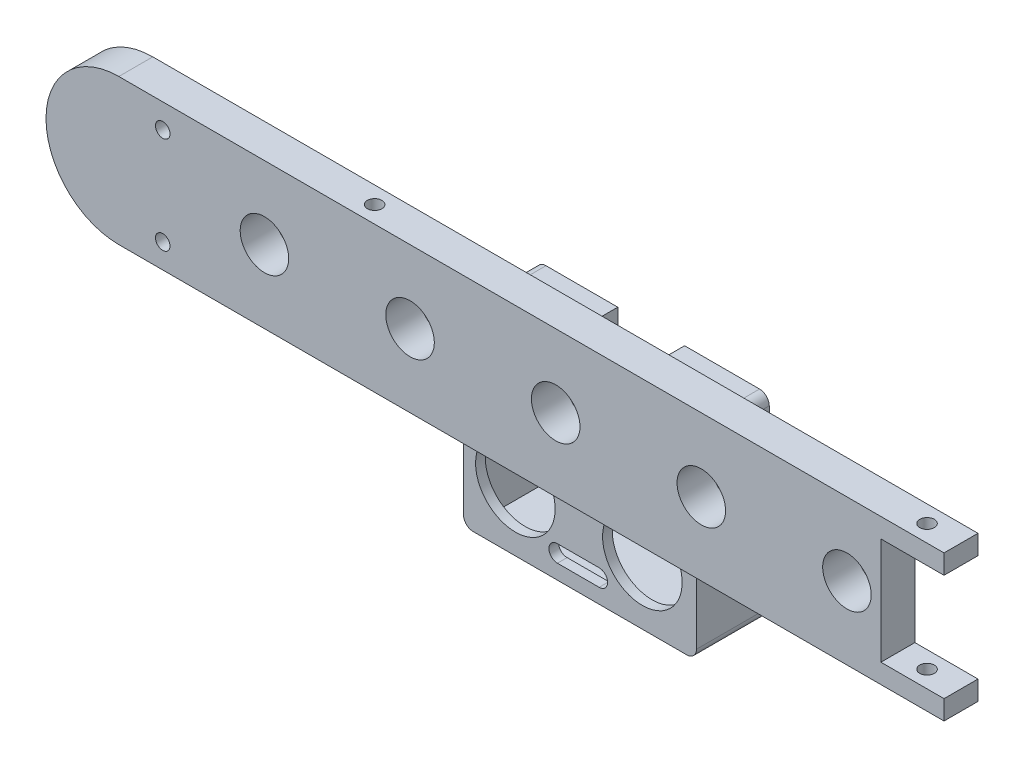
from build123d import *

# Parameters (mm, degrees)
BOSS_EXTRUDE1_DEPTH      = 7
SKETCH2_R                = 5
CUT_EXTRUDE1_DEPTH       = 7
LPATTERN1_COUNT          = 7
LPATTERN1_PITCH          = 30
SKETCH6_R                = 5
CUT_EXTRUDE2_DEPTH       = 10
CUT_EXTRUDE4_REACH       = 219.196
SKETCH9_R                = 1.5
CUT_EXTRUDE9_REACH       = 219.196
SKETCH15_R               = 1.5
SKETCH15_R_2             = 2.5
SKETCH16_W               = 48
SKETCH16_H               = 39.930416712
SKETCH16_R               = 8.2
BOSS_EXTRUDE2_DEPTH      = 15
SKETCH17_W               = 45.833760325
SKETCH17_H               = 30.12512517
SKETCH17_W_2             = 13.763297708
SKETCH17_H_2             = 9.222578979
CUT_EXTRUDE15_DEPTH      = 13
CUT_EXTRUDE16_REACH      = 224.218
SKETCH18_W               = 140
SKETCH18_H               = 115.832892108
FILLET1_R                = 2
BOSS_EXTRUDE4_DEPTH      = 7
CUT_EXTRUDE17_DEPTH      = 10
SKETCH27_W               = 7
SKETCH27_H               = 22
CUT_EXTRUDE18_DEPTH      = 13
CUT_EXTRUDE19_DEPTH      = 266.512692236
CUT_EXTRUDE19_DEPTH_BACK = 266.512692236
SKETCH28_R               = 1.5
CUT_EXTRUDE20_DEPTH      = 266.512692236
CUT_EXTRUDE20_DEPTH_BACK = 266.512692236
SKETCH29_R               = 5


with BuildPart() as part:
    # Sketch1 → Boss-Extrude1 (new body)
    with BuildSketch(Plane.XY):
        with BuildLine():
            Line((-200, 0), (50, 0))
            ThreePointArc((50, 0), (65, -15), (50, -30))
            Line((50, -30), (-200, -30))
            ThreePointArc((-200, -30), (-215, -15), (-200, 0))
        make_face()
    extrude(amount=BOSS_EXTRUDE1_DEPTH)

    # Sketch2 → Cut-Extrude1 (cut)
    with BuildSketch(Plane.XY.offset(7)):
        with Locations((-185, -15)):
            Circle(SKETCH2_R)
    cut_extrude1 = extrude(amount=-CUT_EXTRUDE1_DEPTH, mode=Mode.SUBTRACT)

    # LPattern1: Cut-Extrude1 ×7
    with Locations(*[(i * LPATTERN1_PITCH, 0, 0) for i in range(1, LPATTERN1_COUNT)]):
        add(cut_extrude1, mode=Mode.SUBTRACT)

    # Sketch6 → Cut-Extrude2 (cut)
    with BuildSketch(Plane(origin=(0, 0, 0), x_dir=(-1, 0, 0), z_dir=(0, 0, -1))):
        with Locations((-50, -15)):
            Circle(SKETCH6_R)
    extrude(amount=-CUT_EXTRUDE2_DEPTH, mode=Mode.SUBTRACT)

    # Sketch9 → Cut-Extrude4 (cut, up to next)
    with BuildSketch(Plane(origin=(0, 0, 0), x_dir=(-1, 0, 0), z_dir=(0, 0, -1)), mode=Mode.PRIVATE) as cut_extrude4_sk1:
        with Locations((-29.5, -6.25)):
            Circle(SKETCH9_R)
    cut_extrude4_tool1 = extrude(cut_extrude4_sk1.sketch, amount=-CUT_EXTRUDE4_REACH, mode=Mode.PRIVATE) & part.part
    # Sketch9 → Cut-Extrude4 (cut, up to next)
    with BuildSketch(Plane(origin=(0, 0, 0), x_dir=(-1, 0, 0), z_dir=(0, 0, -1)), mode=Mode.PRIVATE) as cut_extrude4_sk2:
        with Locations((-29.5, -23.75)):
            Circle(SKETCH9_R)
    cut_extrude4_tool2 = extrude(cut_extrude4_sk2.sketch, amount=-CUT_EXTRUDE4_REACH, mode=Mode.PRIVATE) & part.part
    add(cut_extrude4_tool1.solids().sort_by_distance((29.5, -6.25, 0))[0], mode=Mode.SUBTRACT)
    add(cut_extrude4_tool2.solids().sort_by_distance((29.5, -23.75, 0))[0], mode=Mode.SUBTRACT)

    # Sketch15 → Cut-Extrude9 (cut, up to next)
    with BuildSketch(Plane(origin=(0, 0, 0), x_dir=(1, 0, 0), z_dir=(0, 1, 0)), mode=Mode.PRIVATE) as cut_extrude9_sk1:
        with Locations(Location((-195.8, -3.5, 0), (0, 0, 180))):
            Circle(SKETCH15_R)
    cut_extrude9_tool1 = extrude(cut_extrude9_sk1.sketch, amount=-CUT_EXTRUDE9_REACH, mode=Mode.PRIVATE) & part.part
    # Sketch15 → Cut-Extrude9 (cut, up to next)
    with BuildSketch(Plane(origin=(0, 0, 0), x_dir=(1, 0, 0), z_dir=(0, 1, 0)), mode=Mode.PRIVATE) as cut_extrude9_sk2:
        with Locations(Location((45.8, -3.5, 0), (0, 0, 180))):
            Circle(SKETCH15_R_2)
    cut_extrude9_tool2 = extrude(cut_extrude9_sk2.sketch, amount=-CUT_EXTRUDE9_REACH, mode=Mode.PRIVATE) & part.part
    add(cut_extrude9_tool1.solids().sort_by_distance((-195.8, 0, 3.5))[0], mode=Mode.SUBTRACT)
    add(cut_extrude9_tool2.solids().sort_by_distance((45.8, 0, 3.5))[0], mode=Mode.SUBTRACT)

    # Sketch16 → Boss-Extrude2 (add)
    with BuildSketch(Plane(origin=(0, 0, 0), x_dir=(-1, 0, 0), z_dir=(0, 0, -1))):
        with Locations((157, -31.726084321)):
            Rectangle(SKETCH16_W, SKETCH16_H)
        with Locations((144.145834, -39.243444981)):
            Circle(SKETCH16_R, mode=Mode.SUBTRACT)
        with Locations((170.306394211, -39.243444981)):
            Circle(SKETCH16_R, mode=Mode.SUBTRACT)
        with BuildLine():
            Line((153.043612384, -45.175236858), (161.648055614, -45.175236858))
            ThreePointArc((161.648055614, -45.175236858), (163.390378659, -46.917559902), (161.648055614, -48.659882947))
            Line((161.648055614, -48.659882947), (153.043612384, -48.659882947))
            ThreePointArc((153.043612384, -48.659882947), (151.301289339, -46.917559902), (153.043612384, -45.175236858))
        make_face(mode=Mode.SUBTRACT)
    extrude(amount=BOSS_EXTRUDE2_DEPTH)

    # Sketch17 → Cut-Extrude15 (cut)
    with BuildSketch(Plane(origin=(0, 0, -15), x_dir=(-1, 0, 0), z_dir=(0, 0, -1))):
        with Locations((156.666880163, -35.963336462)):
            Rectangle(SKETCH17_W, SKETCH17_H)
        with Locations((157.326506844, -16.372165454)):
            Rectangle(SKETCH17_W_2, SKETCH17_H_2)
    extrude(amount=-CUT_EXTRUDE15_DEPTH, mode=Mode.SUBTRACT)

    # Sketch18 → Cut-Extrude16 (cut, up to next)
    with BuildSketch(Plane.XY.offset(7), mode=Mode.PRIVATE) as cut_extrude16_sk1:
        with Locations((-5, -15.036727437)):
            Rectangle(SKETCH18_W, SKETCH18_H)
    cut_extrude16_tool1 = extrude(cut_extrude16_sk1.sketch, amount=-CUT_EXTRUDE16_REACH, mode=Mode.PRIVATE) & part.part
    add(cut_extrude16_tool1.solids().sort_by_distance((-5, -15.036727, 7))[0], mode=Mode.SUBTRACT)

    # Fillet1
    # the kernel refuses this fillet: 2 mm, written as the material it takes off along each edge
    with BuildSketch(Plane(origin=(-133, -51.691292677, 5), x_dir=(0, 1, 0), z_dir=(0, 0, -1))) as fillet1_piece_1:
        with BuildLine():
            CenterArc((FILLET1_R, -FILLET1_R), FILLET1_R, 90, 90)
            Line((0, -FILLET1_R), (0, 0))
            Line((0, 0), (FILLET1_R, 0))
        make_face()
    extrude(amount=25, mode=Mode.SUBTRACT)
    with BuildSketch(Plane(origin=(-181, -51.691292677, 5), x_dir=(0, 1, 0), z_dir=(0, 0, -1))) as fillet1_piece_2:
        with BuildLine():
            CenterArc((FILLET1_R, FILLET1_R), FILLET1_R, 180, 90)
            Line((0, FILLET1_R), (0, 0))
            Line((0, 0), (FILLET1_R, 0))
        make_face()
    extrude(amount=25, mode=Mode.SUBTRACT)
    with BuildSketch(Plane(origin=(-181, -11.760875965, 0), x_dir=(0, -1, 0), z_dir=(0, 0, -1)), Plane(origin=(-133, -11.760875965, 0), x_dir=(-1, 0, 0), z_dir=(0, 0, -1))) as fillet1_piece_3:
        with BuildLine():
            CenterArc((FILLET1_R, -FILLET1_R), FILLET1_R, 90, 90)
            Line((0, -FILLET1_R), (0, 0))
            Line((0, 0), (FILLET1_R, 0))
        make_face()
    extrude(amount=20, mode=Mode.SUBTRACT)

    # Sketch24 → Boss-Extrude4 (add)
    with BuildSketch(Plane(origin=(0, 0, 0), x_dir=(-1, 0, 0), z_dir=(0, 0, -1))):
        with BuildLine():
            ThreePointArc((245, 0), (260, -15), (245, -30))
            Line((245, -30), (245, 0))
        make_face()
        with BuildLine():
            Line((245, 0), (245, -30))
            Line((245, -30), (200, -30))
            ThreePointArc((200, -30), (215, -15), (200, 0))
            Line((200, 0), (245, 0))
        make_face()
    extrude(amount=-BOSS_EXTRUDE4_DEPTH)

    # Sketch25 → Cut-Extrude17 (cut)
    with BuildSketch(Plane(origin=(0, 0, 0), x_dir=(-1, 0, 0), z_dir=(0, 0, -1))):
        with BuildLine():
            ThreePointArc((237.45, -25), (237.010660172, -23.939339828), (235.95, -23.5))
            Line((235.95, -23.5), (235.95, -26.5))
            ThreePointArc((235.95, -26.5), (237.010660172, -26.060660172), (237.45, -25))
        make_face()
        with BuildLine():
            Line((235.95, -26.5), (235.95, -23.5))
            ThreePointArc((235.95, -23.5), (234.45, -25), (235.95, -26.5))
        make_face()
        with BuildLine():
            ThreePointArc((237.45, -5), (237.010660172, -3.939339828), (235.95, -3.5))
            Line((235.95, -3.5), (235.95, -6.5))
            ThreePointArc((235.95, -6.5), (237.010660172, -6.060660172), (237.45, -5))
        make_face()
        with BuildLine():
            Line((235.95, -6.5), (235.95, -3.5))
            ThreePointArc((235.95, -3.5), (234.45, -5), (235.95, -6.5))
        make_face()
    extrude(amount=-CUT_EXTRUDE17_DEPTH, mode=Mode.SUBTRACT)

    # Sketch27 → Cut-Extrude18 (cut)
    with BuildSketch(Plane(origin=(-75, 0, 0), x_dir=(0, 0, -1), z_dir=(1, 0, 0))):
        with Locations((-3.5, -15)):
            Rectangle(SKETCH27_W, SKETCH27_H)
    extrude(amount=-CUT_EXTRUDE18_DEPTH, mode=Mode.SUBTRACT)

    # Sketch28 → Cut-Extrude19 (cut, two sides: drawn at the far end of the back side and taken through both)
    with BuildSketch(Plane(origin=(0, 0, 0), x_dir=(1, 0, 0), z_dir=(0, 1, 0)).offset(-CUT_EXTRUDE19_DEPTH_BACK)):
        with Locations(Location((-82, -3.5, 0), (0, 0, 180))):
            Circle(SKETCH28_R)
    extrude(amount=CUT_EXTRUDE19_DEPTH + CUT_EXTRUDE19_DEPTH_BACK, mode=Mode.SUBTRACT)

    # Sketch29 → Cut-Extrude20 (cut, two sides: drawn at the far end of the back side and taken through both)
    with BuildSketch(Plane(origin=(0, 0, 0), x_dir=(-1, 0, 0), z_dir=(0, 0, -1)).offset(-CUT_EXTRUDE20_DEPTH_BACK)):
        with Locations((215, -15)):
            Circle(SKETCH29_R)
    extrude(amount=CUT_EXTRUDE20_DEPTH + CUT_EXTRUDE20_DEPTH_BACK, mode=Mode.SUBTRACT)


solid = part.part
